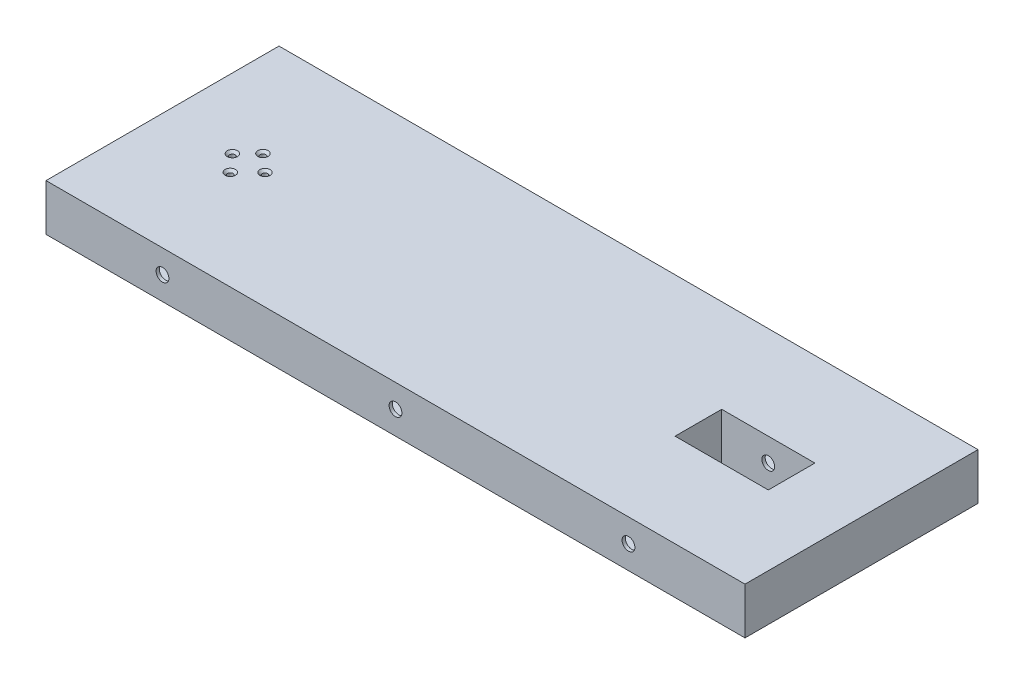
from build123d import *
from build123d.topology import SkipClean

# Parameters (mm, degrees)
SKETCH1_W                                       = 300
SKETCH1_H                                       = 100
BOSS_EXTRUDE1_DEPTH                             = 20
CSK_FOR_M2_FLAT_HEAD_MACHINE_SCREW1_D           = 2.4
CSK_FOR_M2_FLAT_HEAD_MACHINE_SCREW1_DEPTH       = 15
CSK_FOR_M2_FLAT_HEAD_MACHINE_SCREW1_CSINK_D     = 4.4
CSK_FOR_M2_FLAT_HEAD_MACHINE_SCREW1_CSINK_ANGLE = 90
CSK_FOR_M2_FLAT_HEAD_MACHINE_SCREW1_TIP         = 0.721032743
SKETCH5_W                                       = 40
SKETCH5_H                                       = 20
CUT_EXTRUDE1_DEPTH                              = 160.373774505
SHELL1_START                                    = 1.4
SHELL1_OUTLINE_W                                = 297.2
SHELL1_OUTLINE_H                                = 97.2
SHELL1_OUTLINE_R                                = 2.6
SHELL1_OUTLINE_W_2                              = 42.8
SHELL1_OUTLINE_H_2                              = 22.8
SHELL1_DEPTH                                    = 17.020100913
SHELL1_2_OUTLINE_R                              = 2.6
SHELL1_2_DEPTH                                  = 1.245680401
SHELL1_START_2                                  = 18.420101013
SHELL1_4_OUTLINE_W                              = 297.2
SHELL1_4_OUTLINE_H                              = 97.2
SHELL1_4_OUTLINE_W_2                            = 42.8
SHELL1_4_OUTLINE_H_2                            = 22.8
SHELL1_4_OUTLINE_W_3                            = 40
SHELL1_4_OUTLINE_H_3                            = 20
SHELL1_4_DEPTH                                  = 0.179898987
CBORE_FOR_M5_HEX_HEAD_BOLT1_D                   = 5.5
CBORE_FOR_M5_HEX_HEAD_BOLT1_CBORE_D             = 12.24
CBORE_FOR_M5_HEX_HEAD_BOLT1_CBORE_DEPTH         = 3.58


with BuildPart() as part:
    # Sketch1 → Boss-Extrude1 (new body)
    with BuildSketch(Plane(origin=(0, 0, 0), x_dir=(1, 0, 0), z_dir=(0, 1, 0))):
        Rectangle(SKETCH1_W, SKETCH1_H)
    extrude(amount=BOSS_EXTRUDE1_DEPTH)

    # CSK for M2 Flat Head Machine Screw1
    with Locations(Plane(origin=(0, 20, 0), x_dir=(1, 0, 0), z_dir=(0, 1, 0))):
        with Locations((-120, 0), (-106, 0), (-113.505077549, 6.60861642), (-113.505077549, -7.39138358)):
            CounterSinkHole(CSK_FOR_M2_FLAT_HEAD_MACHINE_SCREW1_D / 2, CSK_FOR_M2_FLAT_HEAD_MACHINE_SCREW1_CSINK_D / 2, depth=CSK_FOR_M2_FLAT_HEAD_MACHINE_SCREW1_DEPTH, counter_sink_angle=CSK_FOR_M2_FLAT_HEAD_MACHINE_SCREW1_CSINK_ANGLE)
            with Locations((0, 0, -(CSK_FOR_M2_FLAT_HEAD_MACHINE_SCREW1_DEPTH + CSK_FOR_M2_FLAT_HEAD_MACHINE_SCREW1_TIP / 2))):  # 118° drill point
                Cone(0, CSK_FOR_M2_FLAT_HEAD_MACHINE_SCREW1_D / 2, CSK_FOR_M2_FLAT_HEAD_MACHINE_SCREW1_TIP, mode=Mode.SUBTRACT)

    # Sketch5 → Cut-Extrude1 (cut, through all)
    with BuildSketch(Plane(origin=(0, 20, 0), x_dir=(1, 0, 0), z_dir=(0, 1, 0))):
        with Locations((100, 0)):
            Rectangle(SKETCH5_W, SKETCH5_H)
    extrude(amount=-CUT_EXTRUDE1_DEPTH, mode=Mode.SUBTRACT)

    # Shell1: read off the stored shape, not the designer's step
    # Shell1 outline → Shell1 (cut)
    with BuildSketch(Plane(origin=(0, 0, 0), x_dir=(1, 0, 0), z_dir=(0, 1, 0)).offset(SHELL1_START)):
        Rectangle(SHELL1_OUTLINE_W, SHELL1_OUTLINE_H)
        with Locations((-113.505077549, -7.39138358)):
            Circle(SHELL1_OUTLINE_R, mode=Mode.SUBTRACT)
        with Locations((-120, 0)):
            Circle(SHELL1_OUTLINE_R, mode=Mode.SUBTRACT)
        with Locations((-113.505077549, 6.60861642)):
            Circle(SHELL1_OUTLINE_R, mode=Mode.SUBTRACT)
        with Locations((-106, 0)):
            Circle(SHELL1_OUTLINE_R, mode=Mode.SUBTRACT)
        with Locations((100, 0)):
            Rectangle(SHELL1_OUTLINE_W_2, SHELL1_OUTLINE_H_2, mode=Mode.SUBTRACT)
    extrude(amount=SHELL1_DEPTH, mode=Mode.SUBTRACT)

    # Shell1 2 outline → Shell1 2 (cut)
    with BuildSketch(Plane(origin=(0, 0, 0), x_dir=(1, 0, 0), z_dir=(0, 1, 0)).offset(SHELL1_START)):
        with Locations((-113.505077549, -7.39138358)):
            Circle(SHELL1_2_OUTLINE_R)
        with Locations((-113.505077549, 6.60861642)):
            Circle(SHELL1_2_OUTLINE_R)
        with Locations((-106, 0)):
            Circle(SHELL1_2_OUTLINE_R)
        with Locations((-120, 0)):
            Circle(SHELL1_2_OUTLINE_R)
    extrude(amount=SHELL1_2_DEPTH, mode=Mode.SUBTRACT)

    # Shell1 3 outline → Shell1 3 (revolve, cut)
    with BuildSketch(Plane(origin=(-113.505077549, 0, 7.39138358), x_dir=(1, 0, 0), z_dir=(0, 0, 1))):
        Polygon((268.018855143, 18.6), (2.779898987, 18.6), (2.6, 18.420101013), (268.018855143, 18.420101013), align=None)
        Polygon((2.6, 2.645680501), (2.6, 4.207918111), (0, 2.645680501), align=None)
    revolve(axis=Axis((-113.505077549, 0, 7.39138358), (0, 1, 0)), mode=Mode.SUBTRACT)

    # Shell1 4 outline → Shell1 4 (add)
    # profile 1 of 2: a face of its own
    with BuildSketch(Plane(origin=(0, 0, 0), x_dir=(1, 0, 0), z_dir=(0, 1, 0)).offset(SHELL1_START_2)):
        with BuildLine():
            Line((150, -50), (150, 41.590049821))
            ThreePointArc((150, 41.590049821), (149.323371513, 45.099692578), (148.6, 48.6))
            ThreePointArc((148.6, 48.6), (148.449442912, 49.300202411), (148.297015267, 50))
            Line((148.297015267, 50), (-150, 50))
            Line((-150, 50), (-150, -50))
            Line((-150, -50), (150, -50))
        make_face()
        Rectangle(SHELL1_4_OUTLINE_W, SHELL1_4_OUTLINE_H, mode=Mode.SUBTRACT)
    # profile 2 of 2: a face of its own
    with BuildSketch(Plane(origin=(0, 0, 0), x_dir=(1, 0, 0), z_dir=(0, 1, 0)).offset(SHELL1_START_2)):
        with Locations((100, 0)):
            Rectangle(SHELL1_4_OUTLINE_W_2, SHELL1_4_OUTLINE_H_2)
        with Locations((100, 0)):
            Rectangle(SHELL1_4_OUTLINE_W_3, SHELL1_4_OUTLINE_H_3, mode=Mode.SUBTRACT)
    extrude(amount=SHELL1_4_DEPTH)

    # Shell1 5 outline → Shell1 5 (revolve)
    with SkipClean():  # the faces are left unmerged after this step: merging them gives an invalid solid
        with BuildSketch(Plane(origin=(-113.505077549, 0, -6.60861642), x_dir=(1, 0, 0), z_dir=(0, 0, 1))):
            Polygon((2.779898987, 18.6), (1.2, 18.6), (1.2, 18.420101013), (2.6, 18.420101013), align=None)
        revolve(axis=Axis((-113.505077549, 0, -6.60861642), (0, 1, 0)))
    add(part.part.scale(1), mode=Mode.REPLACE)  # the faces are merged on a copy

    # Shell1 6 outline → Shell1 6 (revolve)
    with SkipClean():  # the faces are left unmerged after this step: merging them gives an invalid solid
        with BuildSketch(Plane(origin=(-106, 0, 0), x_dir=(1, 0, 0), z_dir=(0, 0, 1))):
            Polygon((2.779898987, 18.6), (1.2, 18.6), (1.2, 18.420101013), (2.6, 18.420101013), align=None)
        revolve(axis=Axis((-106, 0, 0), (0, 1, 0)))
    add(part.part.scale(1), mode=Mode.REPLACE)  # the faces are merged on a copy

    # Shell1 7 outline → Shell1 7 (revolve)
    with SkipClean():  # the faces are left unmerged after this step: merging them gives an invalid solid
        with BuildSketch(Plane(origin=(-120, 0, 0), x_dir=(1, 0, 0), z_dir=(0, 0, 1))):
            Polygon((2.779898987, 18.6), (1.2, 18.6), (1.2, 18.420101013), (2.6, 18.420101013), align=None)
        revolve(axis=Axis((-120, 0, 0), (0, 1, 0)))
    add(part.part.scale(1), mode=Mode.REPLACE)  # the faces are merged on a copy

    # Shell1 8 outline → Shell1 8 (revolve, cut)
    with BuildSketch(Plane(origin=(-113.505077549, 0, -6.60861642), x_dir=(1, 0, 0), z_dir=(0, 0, 1))):
        Polygon((0, 2.645680426), (2.6, 2.645680401), (2.6, 4.207918111), align=None)
    revolve(axis=Axis((-113.505077549, 0, -6.60861642), (0, 1, 0)), mode=Mode.SUBTRACT)

    # Shell1 9 outline → Shell1 9 (revolve, cut)
    with BuildSketch(Plane(origin=(-106, 0, 0), x_dir=(1, 0, 0), z_dir=(0, 0, 1))):
        Polygon((0, 2.645680426), (2.6, 2.645680401), (2.6, 4.207918111), align=None)
    revolve(axis=Axis((-106, 0, 0), (0, 1, 0)), mode=Mode.SUBTRACT)

    # Shell1 10 outline → Shell1 10 (revolve, cut)
    with BuildSketch(Plane(origin=(-120, 0, 0), x_dir=(1, 0, 0), z_dir=(0, 0, 1))):
        Polygon((0, 2.645680426), (2.6, 2.645680401), (2.6, 4.207918111), align=None)
    revolve(axis=Axis((-120, 0, 0), (0, 1, 0)), mode=Mode.SUBTRACT)

    # CBORE for M5 Hex Head Bolt1 (through all)
    with Locations(Plane(origin=(0, 0, -50), x_dir=(-1, 0, 0), z_dir=(0, 0, -1))):
        with Locations((0, 10), (-100, 10), (100, 10)):
            CounterBoreHole(CBORE_FOR_M5_HEX_HEAD_BOLT1_D / 2, CBORE_FOR_M5_HEX_HEAD_BOLT1_CBORE_D / 2, CBORE_FOR_M5_HEX_HEAD_BOLT1_CBORE_DEPTH)


solid = part.part
